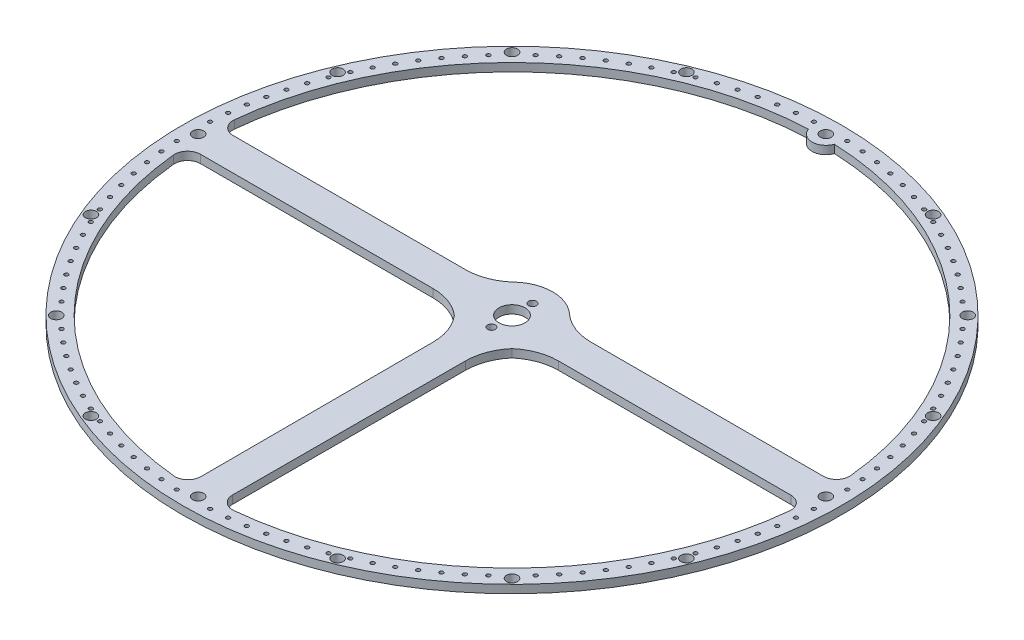
from build123d import *

# Parameters (mm, degrees)
SKETCH4_R           = 128.5748
BOSS_EXTRUDE1_DEPTH = 3.175
CUT_EXTRUDE2_DEPTH  = 182.859943404
SKETCH5_R           = 2.159
SKETCH5_R_2         = 0.75
CUT_EXTRUDE3_DEPTH  = 182.859943404
SCREW_HOLES_R       = 1.513296856
SCREW_HOLES_R_2     = 5.08
MIDDLE_HOLES_DEPTH  = 182.859943404
FILLETMIDDLE_R      = 20.32
FILLETSIDES_R       = 5.08
SKETCH6_R           = 2.159
CUT_EXTRUDE5_DEPTH  = 182.859943404


with BuildPart() as part:
    # Sketch4 → Boss-Extrude1 (new body)
    with BuildSketch(Plane(origin=(0, 0, 0), x_dir=(1, 0, 0), z_dir=(0, 1, 0))):
        with Locations(Location((0, 0, 0), (0, 0, 270))):
            Circle(SKETCH4_R)
    extrude(amount=BOSS_EXTRUDE1_DEPTH)

    # Sketch1 → Cut-Extrude2 (cut, through all)
    with BuildSketch(Plane(origin=(0, 0, 0), x_dir=(1, 0, 0), z_dir=(0, 1, 0))):
        with BuildLine():
            Line((-14.549677831, 6.35), (-120.640477137, 6.35))
            ThreePointArc((-120.640477137, 6.35), (-84.973089506, 85.872121691), (-5.08, 120.700624787))
            Line((-5.08, 120.700624787), (-5.08, 110.497347717))
            Line((-5.08, 110.497347717), (5.08, 110.497347717))
            Line((5.08, 110.497347717), (5.08, 120.700624787))
            ThreePointArc((5.08, 120.700624787), (84.973089506, 85.872121691), (120.640477137, 6.35))
            Line((120.640477137, 6.35), (14.549677831, 6.35))
            ThreePointArc((14.549677831, 6.35), (0, 15.875), (-14.549677831, 6.35))
        make_face()
        with BuildLine():
            Line((120.640477137, -6.35), (14.549677831, -6.35))
            ThreePointArc((14.549677831, -6.35), (11.225320151, -11.225320151), (6.35, -14.549677831))
            Line((6.35, -14.549677831), (6.170997174, -120.649765925))
            ThreePointArc((6.170997174, -120.649765925), (85.360392612, -85.487137027), (120.640477137, -6.35))
        make_face()
        with BuildLine():
            Line((-6.35, -14.549677831), (-6.170997174, -120.649765925))
            ThreePointArc((-6.170997174, -120.649765925), (-85.360392612, -85.487137027), (-120.640477137, -6.35))
            Line((-120.640477137, -6.35), (-14.549677831, -6.35))
            ThreePointArc((-14.549677831, -6.35), (-11.225320151, -11.225320151), (-6.35, -14.549677831))
        make_face()
    extrude(amount=CUT_EXTRUDE2_DEPTH, mode=Mode.SUBTRACT)

    # Sketch5 → Cut-Extrude3 (cut, through all)
    with BuildSketch(Plane(origin=(0, 0, 0), x_dir=(1, 0, 0), z_dir=(0, 1, 0))):
        with Locations(Location((0, 122.4534, 0), (0, 0, 270))):
            Circle(SKETCH5_R)
        with Locations(Location((88.904535599, -88.904535599, 0), (0, 0, 270))):
            Circle(SKETCH5_R)
        with Locations(Location((48.114787951, -116.159373623, 0), (0, 0, 270))):
            Circle(SKETCH5_R)
        with Locations(Location((-48.114787951, -116.159373623, 0), (0, 0, 270))):
            Circle(SKETCH5_R)
        with Locations(Location((-88.904535599, -88.904535599, 0), (0, 0, 270))):
            Circle(SKETCH5_R)
        with Locations(Location((-116.159373623, -48.114787951, 0), (0, 0, 270))):
            Circle(SKETCH5_R)
        with Locations(Location((-116.159373623, 48.114787951, 0), (0, 0, 270))):
            Circle(SKETCH5_R)
        with Locations(Location((-88.904535599, 88.904535599, 0), (0, 0, 270))):
            Circle(SKETCH5_R)
        with Locations(Location((-48.114787951, 116.159373623, 0), (0, 0, 270))):
            Circle(SKETCH5_R)
        with Locations(Location((48.114787951, 116.159373623, 0), (0, 0, 270))):
            Circle(SKETCH5_R)
        with Locations(Location((88.904535599, 88.904535599, 0), (0, 0, 270))):
            Circle(SKETCH5_R)
        with Locations(Location((116.159373623, 48.114787951, 0), (0, 0, 270))):
            Circle(SKETCH5_R)
        with Locations(Location((116.159373623, -48.114787951, 0), (0, 0, 270))):
            Circle(SKETCH5_R)
        with Locations(Location((25.876689039, -121.740250387, 0), (0, 0, 270))):
            Circle(SKETCH5_R_2)
        with Locations(Location((19.469833519, -122.92769087, 0), (0, 0, 270))):
            Circle(SKETCH5_R_2)
        with Locations(Location((13.009612538, -123.778195098, 0), (0, 0, 270))):
            Circle(SKETCH5_R_2)
        with Locations(Location((6.513733114, -124.289431896, 0), (0, 0, 270))):
            Circle(SKETCH5_R_2)
        with Locations(Location((-6.513733114, -124.289431896, 0), (0, 0, 270))):
            Circle(SKETCH5_R_2)
        with Locations(Location((-13.009612538, -123.778195098, 0), (0, 0, 270))):
            Circle(SKETCH5_R_2)
        with Locations(Location((-19.469833519, -122.92769087, 0), (0, 0, 270))):
            Circle(SKETCH5_R_2)
        with Locations(Location((-25.876689039, -121.740250387, 0), (0, 0, 270))):
            Circle(SKETCH5_R_2)
        with Locations(Location((-32.212618353, -120.21912834, 0), (0, 0, 270))):
            Circle(SKETCH5_R_2)
        with Locations(Location((-38.46025512, -118.368494018, 0), (0, 0, 270))):
            Circle(SKETCH5_R_2)
        with Locations(Location((-44.602475, -116.193419882, 0), (0, 0, 270))):
            Circle(SKETCH5_R_2)
        with Locations(Location((-50.622442597, -113.699867658, 0), (0, 0, 270))):
            Circle(SKETCH5_R_2)
        with Locations(Location((-56.503657598, -110.894672, 0), (0, 0, 270))):
            Circle(SKETCH5_R_2)
        with Locations(Location((-62.23, -107.785521755, 0), (0, 0, 270))):
            Circle(SKETCH5_R_2)
        with Locations(Location((-67.785774298, -104.380938886, 0), (0, 0, 270))):
            Circle(SKETCH5_R_2)
        with Locations(Location((-73.1557525, -100.69025512, 0), (0, 0, 270))):
            Circle(SKETCH5_R_2)
        with Locations(Location((-78.32521587, -96.723586363, 0), (0, 0, 270))):
            Circle(SKETCH5_R_2)
        with Locations(Location((-83.279995267, -92.491804979, 0), (0, 0, 270))):
            Circle(SKETCH5_R_2)
        with Locations(Location((-92.491804979, -83.279995267, 0), (0, 0, 270))):
            Circle(SKETCH5_R_2)
        with Locations(Location((-96.723586363, -78.32521587, 0), (0, 0, 270))):
            Circle(SKETCH5_R_2)
        with Locations(Location((-100.69025512, -73.1557525, 0), (0, 0, 270))):
            Circle(SKETCH5_R_2)
        with Locations(Location((-104.380938886, -67.785774298, 0), (0, 0, 270))):
            Circle(SKETCH5_R_2)
        with Locations(Location((-107.785521755, -62.23, 0), (0, 0, 270))):
            Circle(SKETCH5_R_2)
        with Locations(Location((-110.894672, -56.503657598, 0), (0, 0, 270))):
            Circle(SKETCH5_R_2)
        with Locations(Location((-113.699867658, -50.622442597, 0), (0, 0, 270))):
            Circle(SKETCH5_R_2)
        with Locations(Location((-116.193419882, -44.602475, 0), (0, 0, 270))):
            Circle(SKETCH5_R_2)
        with Locations(Location((-118.368494018, -38.46025512, 0), (0, 0, 270))):
            Circle(SKETCH5_R_2)
        with Locations(Location((-120.21912834, -32.212618353, 0), (0, 0, 270))):
            Circle(SKETCH5_R_2)
        with Locations(Location((-121.740250387, -25.876689039, 0), (0, 0, 270))):
            Circle(SKETCH5_R_2)
        with Locations(Location((-122.92769087, -19.469833519, 0), (0, 0, 270))):
            Circle(SKETCH5_R_2)
        with Locations(Location((-123.778195098, -13.009612538, 0), (0, 0, 270))):
            Circle(SKETCH5_R_2)
        with Locations(Location((-124.289431896, -6.513733114, 0), (0, 0, 270))):
            Circle(SKETCH5_R_2)
        with Locations(Location((-124.289431896, 6.513733114, 0), (0, 0, 270))):
            Circle(SKETCH5_R_2)
        with Locations(Location((-123.778195098, 13.009612538, 0), (0, 0, 270))):
            Circle(SKETCH5_R_2)
        with Locations(Location((-122.92769087, 19.469833519, 0), (0, 0, 270))):
            Circle(SKETCH5_R_2)
        with Locations(Location((-121.740250387, 25.876689039, 0), (0, 0, 270))):
            Circle(SKETCH5_R_2)
        with Locations(Location((-120.21912834, 32.212618353, 0), (0, 0, 270))):
            Circle(SKETCH5_R_2)
        with Locations(Location((-118.368494018, 38.46025512, 0), (0, 0, 270))):
            Circle(SKETCH5_R_2)
        with Locations(Location((-116.193419882, 44.602475, 0), (0, 0, 270))):
            Circle(SKETCH5_R_2)
        with Locations(Location((-113.699867658, 50.622442597, 0), (0, 0, 270))):
            Circle(SKETCH5_R_2)
        with Locations(Location((-110.894672, 56.503657598, 0), (0, 0, 270))):
            Circle(SKETCH5_R_2)
        with Locations(Location((-107.785521755, 62.23, 0), (0, 0, 270))):
            Circle(SKETCH5_R_2)
        with Locations(Location((-104.380938886, 67.785774298, 0), (0, 0, 270))):
            Circle(SKETCH5_R_2)
        with Locations(Location((-100.69025512, 73.1557525, 0), (0, 0, 270))):
            Circle(SKETCH5_R_2)
        with Locations(Location((-96.723586363, 78.32521587, 0), (0, 0, 270))):
            Circle(SKETCH5_R_2)
        with Locations(Location((-92.491804979, 83.279995267, 0), (0, 0, 270))):
            Circle(SKETCH5_R_2)
        with Locations(Location((-83.279995267, 92.491804979, 0), (0, 0, 270))):
            Circle(SKETCH5_R_2)
        with Locations(Location((-78.32521587, 96.723586363, 0), (0, 0, 270))):
            Circle(SKETCH5_R_2)
        with Locations(Location((-73.1557525, 100.69025512, 0), (0, 0, 270))):
            Circle(SKETCH5_R_2)
        with Locations(Location((-67.785774298, 104.380938886, 0), (0, 0, 270))):
            Circle(SKETCH5_R_2)
        with Locations(Location((-62.23, 107.785521755, 0), (0, 0, 270))):
            Circle(SKETCH5_R_2)
        with Locations(Location((-56.503657598, 110.894672, 0), (0, 0, 270))):
            Circle(SKETCH5_R_2)
        with Locations(Location((-50.622442597, 113.699867658, 0), (0, 0, 270))):
            Circle(SKETCH5_R_2)
        with Locations(Location((-44.602475, 116.193419882, 0), (0, 0, 270))):
            Circle(SKETCH5_R_2)
        with Locations(Location((-38.46025512, 118.368494018, 0), (0, 0, 270))):
            Circle(SKETCH5_R_2)
        with Locations(Location((-32.212618353, 120.21912834, 0), (0, 0, 270))):
            Circle(SKETCH5_R_2)
        with Locations(Location((-25.876689039, 121.740250387, 0), (0, 0, 270))):
            Circle(SKETCH5_R_2)
        with Locations(Location((-19.469833519, 122.92769087, 0), (0, 0, 270))):
            Circle(SKETCH5_R_2)
        with Locations(Location((-13.009612538, 123.778195098, 0), (0, 0, 270))):
            Circle(SKETCH5_R_2)
        with Locations(Location((-6.513733114, 124.289431896, 0), (0, 0, 270))):
            Circle(SKETCH5_R_2)
        with Locations(Location((6.513733114, 124.289431896, 0), (0, 0, 270))):
            Circle(SKETCH5_R_2)
        with Locations(Location((13.009612538, 123.778195098, 0), (0, 0, 270))):
            Circle(SKETCH5_R_2)
        with Locations(Location((19.469833519, 122.92769087, 0), (0, 0, 270))):
            Circle(SKETCH5_R_2)
        with Locations(Location((25.876689039, 121.740250387, 0), (0, 0, 270))):
            Circle(SKETCH5_R_2)
        with Locations(Location((32.212618353, 120.21912834, 0), (0, 0, 270))):
            Circle(SKETCH5_R_2)
        with Locations(Location((38.46025512, 118.368494018, 0), (0, 0, 270))):
            Circle(SKETCH5_R_2)
        with Locations(Location((44.602475, 116.193419882, 0), (0, 0, 270))):
            Circle(SKETCH5_R_2)
        with Locations(Location((50.622442597, 113.699867658, 0), (0, 0, 270))):
            Circle(SKETCH5_R_2)
        with Locations(Location((56.503657598, 110.894672, 0), (0, 0, 270))):
            Circle(SKETCH5_R_2)
        with Locations(Location((62.23, 107.785521755, 0), (0, 0, 270))):
            Circle(SKETCH5_R_2)
        with Locations(Location((67.785774298, 104.380938886, 0), (0, 0, 270))):
            Circle(SKETCH5_R_2)
        with Locations(Location((73.1557525, 100.69025512, 0), (0, 0, 270))):
            Circle(SKETCH5_R_2)
        with Locations(Location((78.32521587, 96.723586363, 0), (0, 0, 270))):
            Circle(SKETCH5_R_2)
        with Locations(Location((83.279995267, 92.491804979, 0), (0, 0, 270))):
            Circle(SKETCH5_R_2)
        with Locations(Location((92.491804979, 83.279995267, 0), (0, 0, 270))):
            Circle(SKETCH5_R_2)
        with Locations(Location((96.723586363, 78.32521587, 0), (0, 0, 270))):
            Circle(SKETCH5_R_2)
        with Locations(Location((100.69025512, 73.1557525, 0), (0, 0, 270))):
            Circle(SKETCH5_R_2)
        with Locations(Location((104.380938886, 67.785774298, 0), (0, 0, 270))):
            Circle(SKETCH5_R_2)
        with Locations(Location((107.785521755, 62.23, 0), (0, 0, 270))):
            Circle(SKETCH5_R_2)
        with Locations(Location((110.894672, 56.503657598, 0), (0, 0, 270))):
            Circle(SKETCH5_R_2)
        with Locations(Location((113.699867658, 50.622442597, 0), (0, 0, 270))):
            Circle(SKETCH5_R_2)
        with Locations(Location((116.193419882, 44.602475, 0), (0, 0, 270))):
            Circle(SKETCH5_R_2)
        with Locations(Location((118.368494018, 38.46025512, 0), (0, 0, 270))):
            Circle(SKETCH5_R_2)
        with Locations(Location((120.21912834, 32.212618353, 0), (0, 0, 270))):
            Circle(SKETCH5_R_2)
        with Locations(Location((121.740250387, 25.876689039, 0), (0, 0, 270))):
            Circle(SKETCH5_R_2)
        with Locations(Location((122.92769087, 19.469833519, 0), (0, 0, 270))):
            Circle(SKETCH5_R_2)
        with Locations(Location((123.778195098, 13.009612538, 0), (0, 0, 270))):
            Circle(SKETCH5_R_2)
        with Locations(Location((124.289431896, 6.513733114, 0), (0, 0, 270))):
            Circle(SKETCH5_R_2)
        with Locations(Location((124.289431896, -6.513733114, 0), (0, 0, 270))):
            Circle(SKETCH5_R_2)
        with Locations(Location((123.778195098, -13.009612538, 0), (0, 0, 270))):
            Circle(SKETCH5_R_2)
        with Locations(Location((122.92769087, -19.469833519, 0), (0, 0, 270))):
            Circle(SKETCH5_R_2)
        with Locations(Location((121.740250387, -25.876689039, 0), (0, 0, 270))):
            Circle(SKETCH5_R_2)
        with Locations(Location((120.21912834, -32.212618353, 0), (0, 0, 270))):
            Circle(SKETCH5_R_2)
        with Locations(Location((118.368494018, -38.46025512, 0), (0, 0, 270))):
            Circle(SKETCH5_R_2)
        with Locations(Location((116.193419882, -44.602475, 0), (0, 0, 270))):
            Circle(SKETCH5_R_2)
        with Locations(Location((113.699867658, -50.622442597, 0), (0, 0, 270))):
            Circle(SKETCH5_R_2)
        with Locations(Location((110.894672, -56.503657598, 0), (0, 0, 270))):
            Circle(SKETCH5_R_2)
        with Locations(Location((107.785521755, -62.23, 0), (0, 0, 270))):
            Circle(SKETCH5_R_2)
        with Locations(Location((104.380938886, -67.785774298, 0), (0, 0, 270))):
            Circle(SKETCH5_R_2)
        with Locations(Location((100.69025512, -73.1557525, 0), (0, 0, 270))):
            Circle(SKETCH5_R_2)
        with Locations(Location((96.723586363, -78.32521587, 0), (0, 0, 270))):
            Circle(SKETCH5_R_2)
        with Locations(Location((92.491804979, -83.279995267, 0), (0, 0, 270))):
            Circle(SKETCH5_R_2)
        with Locations(Location((83.279995267, -92.491804979, 0), (0, 0, 270))):
            Circle(SKETCH5_R_2)
        with Locations(Location((78.32521587, -96.723586363, 0), (0, 0, 270))):
            Circle(SKETCH5_R_2)
        with Locations(Location((73.1557525, -100.69025512, 0), (0, 0, 270))):
            Circle(SKETCH5_R_2)
        with Locations(Location((67.785774298, -104.380938886, 0), (0, 0, 270))):
            Circle(SKETCH5_R_2)
        with Locations(Location((62.23, -107.785521755, 0), (0, 0, 270))):
            Circle(SKETCH5_R_2)
        with Locations(Location((56.503657598, -110.894672, 0), (0, 0, 270))):
            Circle(SKETCH5_R_2)
        with Locations(Location((50.622442597, -113.699867658, 0), (0, 0, 270))):
            Circle(SKETCH5_R_2)
        with Locations(Location((44.602475, -116.193419882, 0), (0, 0, 270))):
            Circle(SKETCH5_R_2)
        with Locations(Location((38.46025512, -118.368494018, 0), (0, 0, 270))):
            Circle(SKETCH5_R_2)
        with Locations(Location((32.212618353, -120.21912834, 0), (0, 0, 270))):
            Circle(SKETCH5_R_2)
        with BuildLine():
            Line((5.08, 120.700624787), (5.08, 110.497347717))
            Line((5.08, 110.497347717), (-5.08, 110.497347717))
            Line((-5.08, 110.497347717), (-5.08, 120.700624787))
            ThreePointArc((-5.08, 120.700624787), (0, 117.079516772), (5.08, 120.700624787))
        make_face()
    extrude(amount=CUT_EXTRUDE3_DEPTH, mode=Mode.SUBTRACT)

    # Screw holes → middle holes (cut, through all)
    with BuildSketch(Plane(origin=(0, 0, 0), x_dir=(1, 0, 0), z_dir=(0, 1, 0))):
        with Locations(Location((0, 8, 0), (0, 0, 270))):
            Circle(SCREW_HOLES_R)
        with Locations(Location((0, -8, 0), (0, 0, 270))):
            Circle(SCREW_HOLES_R)
        with Locations(Location((0, 0, 0), (0, 0, 270))):
            Circle(SCREW_HOLES_R_2)
    extrude(amount=MIDDLE_HOLES_DEPTH, mode=Mode.SUBTRACT)

    # Filletmiddle
    # the kernel refuses this fillet: 20.32 mm, written as the material it adds along each edge
    with BuildSketch(Plane(origin=(14.549677831, 0, 6.35), x_dir=(1, 0, 0), z_dir=(0, 1, 0))) as filletmiddle_piece_1:
        with BuildLine():
            CenterArc((9.920490231, -20.32), FILLETMIDDLE_R, 90, 42.536898363)
            ThreePointArc((-3.81714798, -5.347368421), (-1.628915718, -2.873314556), (0, 0))
            Line((0, 0), (9.920490231, 0))
        make_face()
    extrude(amount=3.175)
    with BuildSketch(Plane(origin=(6.35, 0, 14.549677831), x_dir=(0.8141048686003456, 0, -0.5807178858285786), z_dir=(0, 1, 0))) as filletmiddle_piece_2:
        with BuildLine():
            CenterArc((10.757390528, -19.881628332), FILLETMIDDLE_R, 101.92287228, 42.479412606)
            Line((-5.765288639, -8.053548473), (0, 0))
            ThreePointArc((0, 0), (3.279692234, -0.342477866), (6.559384468, 0))
        make_face()
    extrude(amount=3.175)
    with BuildSketch(Plane(origin=(-14.549677831, 0, -6.35), x_dir=(0.5809961925274014, 0, -0.8139062748674829), z_dir=(0, 1, 0))) as filletmiddle_piece_3:
        with BuildLine():
            CenterArc((10.774808453, 19.880191881), FILLETMIDDLE_R, 215.520640058, 42.536898363)
            Line((-5.763767052, 8.074349249), (0, 0))
            ThreePointArc((0, 0), (3.285002577, 0.343600093), (6.570005154, 0))
        make_face()
    extrude(amount=3.175)
    with BuildSketch(Plane(origin=(14.549677831, 0, -6.35), x_dir=(1, 0, 0), z_dir=(0, 1, 0)), Plane(origin=(-14.549677831, 0, 6.35), x_dir=(-1, 0, 0), z_dir=(0, 1, 0))) as filletmiddle_piece_4:
        with BuildLine():
            CenterArc((9.920490231, 20.32), FILLETMIDDLE_R, 227.463101637, 42.536898363)
            ThreePointArc((-3.81714798, 5.347368421), (-1.628915718, 2.873314556), (0, 0))
            Line((0, 0), (9.920490231, 0))
        make_face()
    extrude(amount=3.175)
    with BuildSketch(Plane(origin=(-6.35, 0, 14.549677831), x_dir=(0.001687110490148115, 0, 0.9999985768280844), z_dir=(0, 1, 0))) as filletmiddle_piece_5:
        with BuildLine():
            CenterArc((9.904453347, -20.32), FILLETMIDDLE_R, 90, 42.479412606)
            ThreePointArc((-3.818155675, -5.333592771), (-1.630600874, -2.866149513), (0, 0))
            Line((0, 0), (9.904453347, 0))
        make_face()
    extrude(amount=3.175)

    # Filletsides
    filletsides_edges = [part.edges().sort_by_distance(p)[0] for p in [
        (6.170997174, 1.5875, 120.649765925),
        (120.640477137, 1.5875, 6.35),
        (-120.640477137, 1.5875, -6.35),
        (120.640477137, 1.5875, -6.35),
        (-120.640477137, 1.5875, 6.35),
        (-6.170997174, 1.5875, 120.649765925),
    ]]
    fillet(filletsides_edges, radius=FILLETSIDES_R)

    # Sketch6 → Cut-Extrude5 (cut, through all)
    with BuildSketch(Plane(origin=(0, 0, 0), x_dir=(1, 0, 0), z_dir=(0, 1, 0))):
        with Locations(Location((-122.4534, 0, 0), (0, 0, 270))):
            Circle(SKETCH6_R)
        with Locations(Location((0, -122.4534, 0), (0, 0, 270))):
            Circle(SKETCH6_R)
        with Locations(Location((122.4534, 0, 0), (0, 0, 270))):
            Circle(SKETCH6_R)
    extrude(amount=CUT_EXTRUDE5_DEPTH, mode=Mode.SUBTRACT)


solid = part.part
